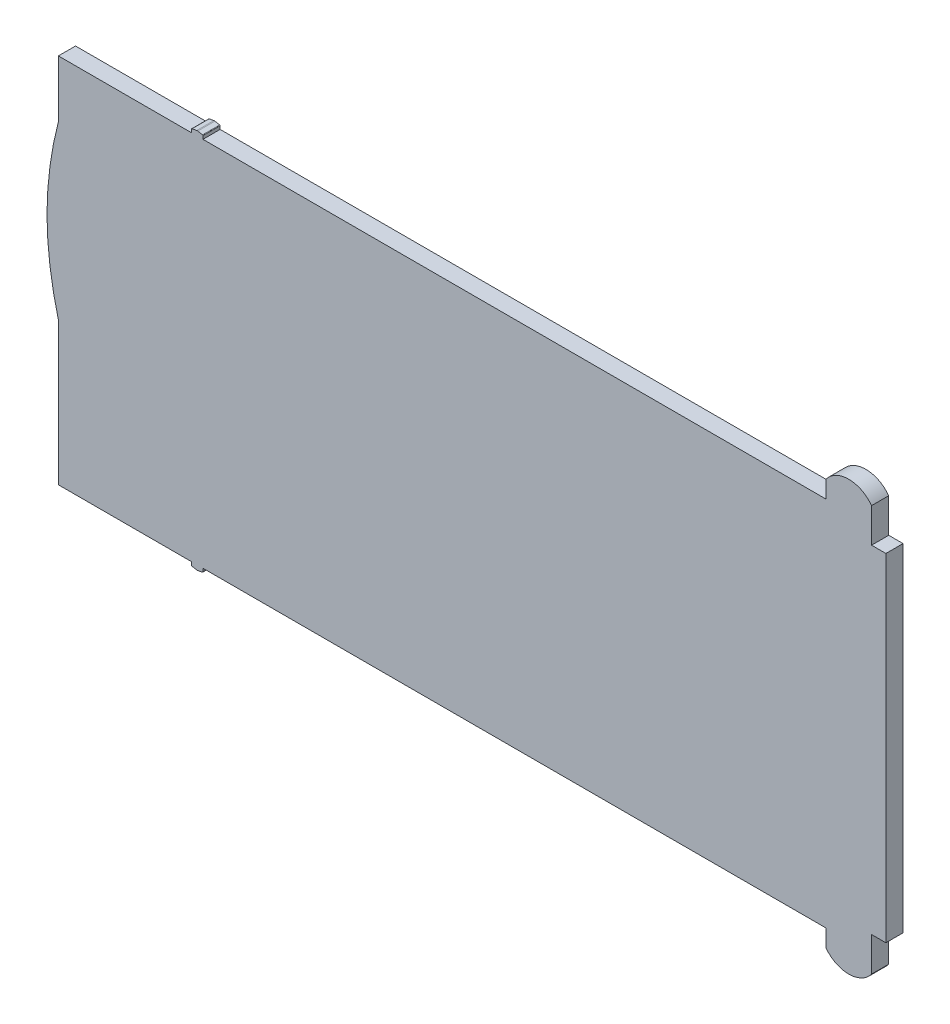
from build123d import *

# Parameters (mm, degrees)
SALIENTE_EXTRUIR1_DEPTH = 3
CROQUIS8_W              = 3
CROQUIS8_H              = 64.999858303
CORTAR_EXTRUIR2_DEPTH   = 0.7
CROQUIS10_W             = 2
CROQUIS10_H             = 30
SALIENTE_EXTRUIR3_DEPTH = 3
REDONDEO2_R             = 60


with BuildPart() as part:
    # Croquis1 → Saliente-Extruir1 (new body)
    with BuildSketch(Plane.XY):
        with BuildLine():
            Line((153.062162769, 17.216958542), (155.56216277, 17.216958542))
            Line((155.56216277, 17.216958542), (155.56216277, 76.216816844))
            Line((155.56216277, 76.216816844), (153.062162769, 76.216816844))
            Line((153.062162769, 76.216816844), (153.062162769, 82.216816846))
            ThreePointArc((153.062162769, 82.216816846), (149.062162768, 84.216694386), (145.062162767, 82.216816846))
            Line((145.062162767, 82.216816846), (145.062162767, 79.216816845))
            Line((145.062162767, 79.216816845), (36.062088373, 79.225159863))
            Line((36.062088373, 79.225159863), (36.062088373, 79.770603401))
            ThreePointArc((36.062088373, 79.770603401), (36.039039485, 79.834466742), (35.980517846, 79.868890504))
            Line((35.980517846, 79.868890504), (35.154268939, 80.023817566))
            ThreePointArc((35.154268939, 80.023817566), (35.062123149, 80.032382053), (34.969977306, 80.023818147))
            Line((34.969977306, 80.023818147), (34.143694323, 79.868890087))
            ThreePointArc((34.143694323, 79.868890087), (34.085172266, 79.834466452), (34.062123176, 79.770602869))
            Line((34.062123176, 79.770602869), (34.062123176, 79.216816845))
            Line((34.062123176, 79.216816845), (10.06212317, 79.216816845))
            Line((10.06212317, 79.216816845), (10.06212317, 14.216958542))
            Line((10.06212317, 14.216958542), (34.043728806, 14.216958542))
            Line((34.043728806, 14.216958542), (34.043728806, 13.671515004))
            ThreePointArc((34.043728806, 13.671515004), (34.066777694, 13.607651663), (34.125299333, 13.573227901))
            Line((34.125299333, 13.573227901), (34.95154824, 13.418300839))
            ThreePointArc((34.95154824, 13.418300839), (35.04369403, 13.409736352), (35.135839873, 13.418300258))
            Line((35.135839873, 13.418300258), (35.962122856, 13.573228317))
            ThreePointArc((35.962122856, 13.573228317), (36.020644913, 13.607651952), (36.043694003, 13.671515536))
            Line((36.043694003, 13.671515536), (36.043694003, 14.22530156))
            Line((36.043694003, 14.22530156), (145.062162767, 14.216958542))
            Line((145.062162767, 14.216958542), (145.062162767, 11.216958541))
            ThreePointArc((145.062162767, 11.216958541), (149.062162768, 9.21695854), (153.062162769, 11.216958541))
            Line((153.062162769, 11.216958541), (153.062162769, 17.216958542))
        make_face()
    extrude(amount=SALIENTE_EXTRUIR1_DEPTH)

    # Croquis8 → Cortar-Extruir2 (cut)
    with BuildSketch(Plane.ZY.offset(-10.06212317)):
        with Locations((1.5, 46.716887694)):
            Rectangle(CROQUIS8_W, CROQUIS8_H)
    extrude(amount=-CORTAR_EXTRUIR2_DEPTH, mode=Mode.SUBTRACT)

    # Croquis10 → Saliente-Extruir3 (add)
    with BuildSketch(Plane(origin=(0, 0, 0), x_dir=(-1, 0, 0), z_dir=(0, 0, -1))):
        with Locations((-9.76212317, 54.216816845)):
            Rectangle(CROQUIS10_W, CROQUIS10_H)
    extrude(amount=-SALIENTE_EXTRUIR3_DEPTH)

    # Redondeo2
    # the kernel refuses this fillet: 60 mm, written as the material it takes off along each edge
    with BuildSketch(Plane(origin=(8.76212317, 69.216816845, -38.405728739), x_dir=(1, 0, 0), z_dir=(0, 0, 1))) as redondeo2_piece_1:
        with BuildLine():
            CenterArc((60, -15.362291496), REDONDEO2_R, 165.164888418, 14.835111582)
            Line((0, -15.362291496), (0, 0))
            Line((0, 0), (2, 0))
        make_face()
    extrude(amount=79.811457479, mode=Mode.SUBTRACT)
    with BuildSketch(Plane(origin=(8.76212317, 39.216816845, -38.405728739), x_dir=(0, 1, 0), z_dir=(0, 0, 1))) as redondeo2_piece_2:
        with BuildLine():
            CenterArc((15.362291496, -60), REDONDEO2_R, 90, 14.835111582)
            Line((0, -2), (0, 0))
            Line((0, 0), (15.362291496, 0))
        make_face()
    extrude(amount=79.811457479, mode=Mode.SUBTRACT)


solid = part.part
